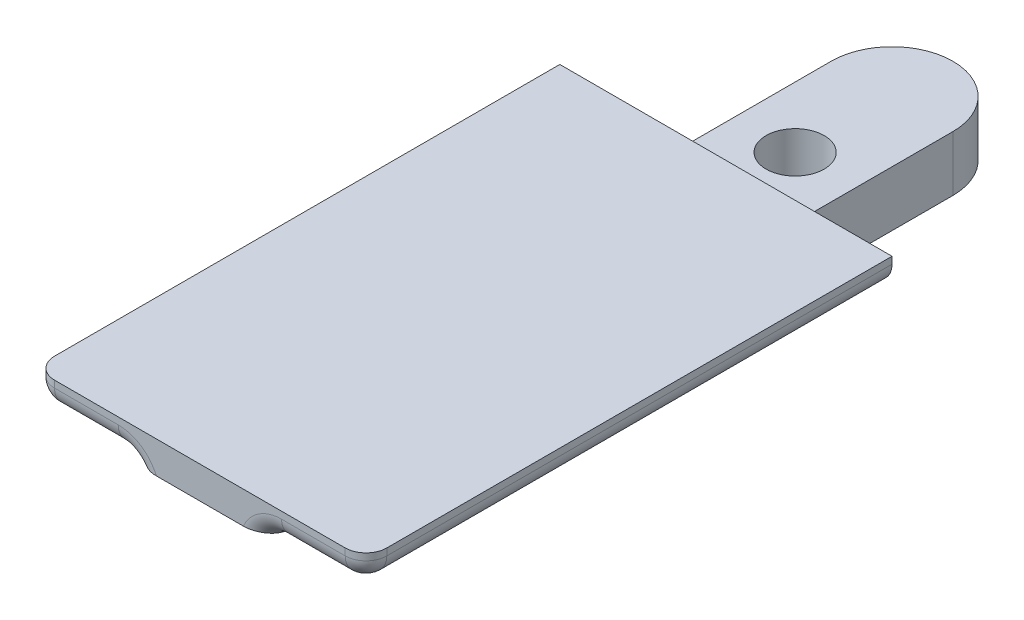
from build123d import *

# Parameters (mm, degrees)
SKETCH2_R           = 2.1
BOSS_EXTRUDE1_DEPTH = 4
BOSS_EXTRUDE2_DEPTH = 2
CHAMFER1_SIZE       = 30
CHAMFER1_SIZE2      = 3.683536827087146
FILLET2_R           = 1.5
FILLET4_R           = 1.5


with BuildPart() as part:
    # Sketch2 → Boss-Extrude1 (new body)
    with BuildSketch(Plane(origin=(0, 0, 0), x_dir=(1, 0, 0), z_dir=(0, 1, 0))):
        with BuildLine():
            Line((-4.4, -1.507e-14), (-4.4, 12))
            ThreePointArc((-4.4, 12), (2.7e-16, 16.4), (4.4, 12))
            Line((4.4, 12), (4.4, 1.507e-14))
            Line((4.4, 1.507e-14), (4.4, -38.000000000000014))
            Line((4.4, -38.000000000000014), (-4.399999999999994, -38.000000000000014))
            Line((-4.399999999999994, -38.000000000000014), (-4.4, -1.507e-14))
        make_face()
        with Locations(Location((0, 5, 0), (0, 0, 270))):
            Circle(SKETCH2_R, mode=Mode.SUBTRACT)
    extrude(amount=BOSS_EXTRUDE1_DEPTH)

    # Sketch3 → Boss-Extrude2 (add)
    with BuildSketch(Plane(origin=(0, 4, 0), x_dir=(1, 0, 0), z_dir=(0, 1, 0))):
        Polygon((-12, 0), (12, 0), (12.000000000000002, -38), (-11.999999999999995, -38), align=None)
    extrude(amount=BOSS_EXTRUDE2_DEPTH)

    # Chamfer1
    chamfer1_edges = [part.edges().sort_by_distance(p)[0] for p in [
        (3.55e-15, 0, 38.000000000000014),
    ]]
    chamfer1_side = [part.faces().sort_by_distance(p)[0] for p in [
        (1.53e-15, 0, 11.756614981879217),
    ]]
    chamfer(chamfer1_edges, length=CHAMFER1_SIZE, length2=CHAMFER1_SIZE2, reference=chamfer1_side[0])

    # Fillet2
    # the kernel refuses this fillet: 1.5 mm, written as the material it adds along each edge
    with BuildSketch(Plane(origin=(-4.399999999999994, 4, 38.000000000000014), x_dir=(-4.14e-15, -1, 0), z_dir=(-1.2e-16, 0, -1))) as fillet2_piece_1_section:
        with BuildLine():
            CenterArc((FILLET2_R, FILLET2_R), FILLET2_R, 180, 89.99999999999977)
            Line((6.22e-15, FILLET2_R), (0, 0))
            Line((0, 0), (FILLET2_R, 0))
        make_face()
    fillet2_piece_1 = extrude(amount=38.000000000000014, mode=Mode.PRIVATE)
    fillet2_piece_1 = split(fillet2_piece_1, bisect_by=Plane(origin=(-4.741166225178414, 1.3298279167086908, 18.830579243267316), z_dir=(0, 0.992546151641322, -0.12186934340514775)), keep=Keep.TOP, mode=Mode.PRIVATE)
    add(fillet2_piece_1)
    with BuildSketch(Plane(origin=(4.4, 4, 0), x_dir=(0, -1, 0), z_dir=(0, 0, 1))) as fillet2_piece_2_section:
        with BuildLine():
            CenterArc((FILLET2_R, FILLET2_R), FILLET2_R, 180, 90)
            Line((0, FILLET2_R), (0, 0))
            Line((0, 0), (FILLET2_R, 0))
        make_face()
    fillet2_piece_2 = extrude(amount=38.000000000000014, mode=Mode.PRIVATE)
    fillet2_piece_2 = split(fillet2_piece_2, bisect_by=Plane(origin=(4.741166225178429, 1.3298279167086202, 18.830579243266737), z_dir=(0, 0.992546151641322, -0.12186934340514775)), keep=Keep.TOP, mode=Mode.PRIVATE)
    add(fillet2_piece_2)
    # the kernel refuses this fillet: 1.5 mm, written as the material it takes off along each edge
    with BuildSketch(Plane(origin=(-11.999999999999995, 4, 41.75), x_dir=(0, 1, 0), z_dir=(-1.4e-16, 0, -1))) as fillet2_2_piece_1:
        with BuildLine():
            CenterArc((FILLET2_R, FILLET2_R), FILLET2_R, 180, 90)
            Line((0, FILLET2_R), (0, 0))
            Line((0, 0), (FILLET2_R, 0))
        make_face()
    extrude(amount=45.5, mode=Mode.SUBTRACT)
    with BuildSketch(Plane(origin=(12, 4, -3.75), x_dir=(-1, 0, 5e-17), z_dir=(5e-17, 0, 1))) as fillet2_2_piece_2:
        with BuildLine():
            CenterArc((FILLET2_R, -FILLET2_R), FILLET2_R, 90, 90)
            Line((0, -FILLET2_R), (0, 0))
            Line((0, 0), (FILLET2_R, 0))
        make_face()
    extrude(amount=45.5, mode=Mode.SUBTRACT)

    # Fillet4
    fillet4_edges = [part.edges().sort_by_distance(p)[0] for p in [
        (5.41281689306181, 3.918679886483928, 38),
        (8.2, 4, 38),
        (11.560660171779821, 4.439339828220179, 38),
        (-5.41281689306181, 3.918679886483928, 38),
        (-8.200000000000001, 4, 38),
        (-11.560660171779821, 4.439339828220179, 38),
        (12.000000000000002, 5.75, 38),
        (-11.999999999999995, 5.75, 38),
    ]]
    fillet(fillet4_edges, radius=FILLET4_R)


solid = part.part
